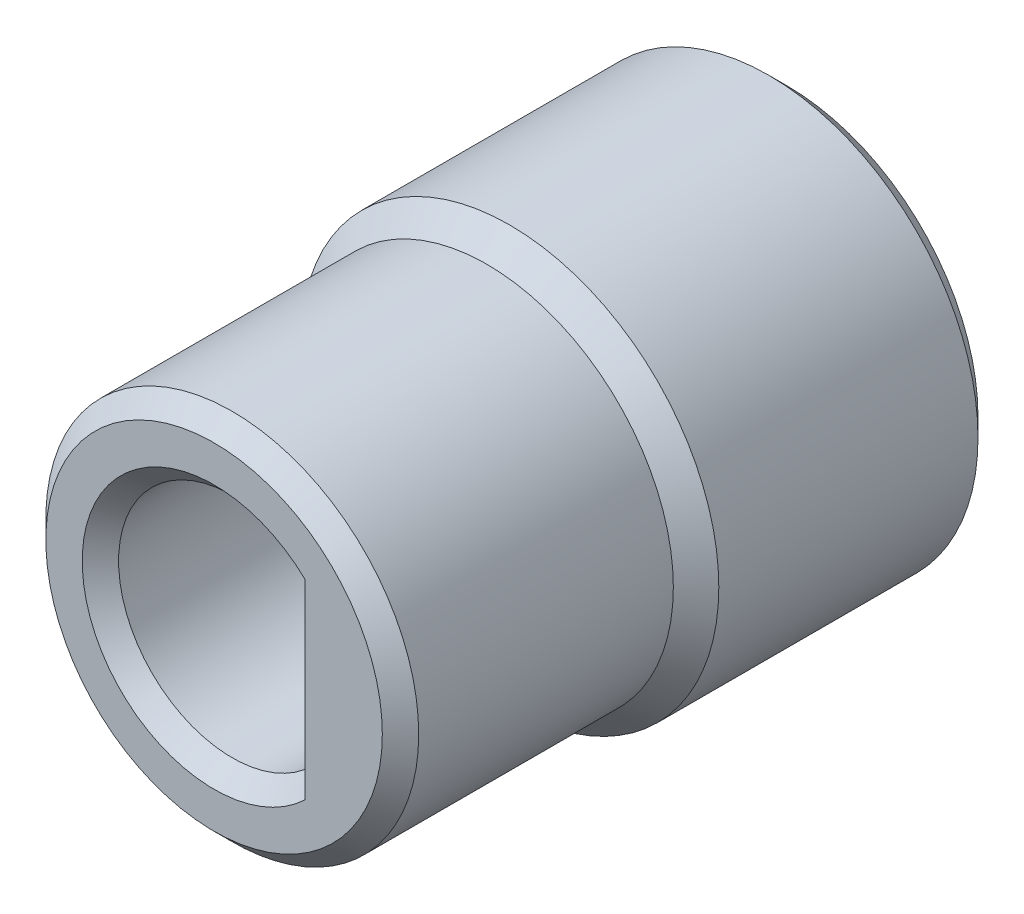
from build123d import *

# Parameters (mm, degrees)
SKETCH1_R           = 4.6
SKETCH1_R_2         = 3
BOSS_EXTRUDE1_DEPTH = 6.6
SKETCH2_R           = 4.1
BOSS_EXTRUDE2_DEPTH = 6
CHAMFER2_SIZE       = 0.5
CHAMFER3_SIZE       = 0.4
CHAMFER4_SIZE       = 0.4
CHAMFER4_SIZE2      = 0.8
CHAMFER5_SIZE       = 0.4


with BuildPart() as part:
    # Sketch1 → Boss-Extrude1 (new body)
    with BuildSketch(Plane.XY):
        Circle(SKETCH1_R)
        Circle(SKETCH1_R_2, mode=Mode.SUBTRACT)
    extrude(amount=BOSS_EXTRUDE1_DEPTH)

    # Sketch2 → Boss-Extrude2 (add)
    with BuildSketch(Plane.XY.offset(6.6)):
        Circle(SKETCH2_R)
        with BuildLine():
            Line((1.6, -1.920937271), (1.6, 1.920937271))
            ThreePointArc((1.6, 1.920937271), (-2.5, 0), (1.6, -1.920937271))
        make_face(mode=Mode.SUBTRACT)
    extrude(amount=BOSS_EXTRUDE2_DEPTH)

    # Chamfer2
    chamfer2_edges = [part.edges().sort_by_distance(p)[0] for p in [
        (-4.6, 0, 6.6),
    ]]
    chamfer(chamfer2_edges, length=CHAMFER2_SIZE - 0.0001)  # a hair under: the kernel refuses the full size

    # Chamfer3
    chamfer3_edges = [part.edges().sort_by_distance(p)[0] for p in [
        (-2.5, 0, 12.6),
        (1.6, 0, 12.6),
        (-3, 0, 0),
    ]]
    chamfer(chamfer3_edges, length=CHAMFER3_SIZE)

    # Chamfer4
    chamfer4_edges = [part.edges().sort_by_distance(p)[0] for p in [
        (-3, 0, 6.6),
    ]]
    chamfer4_side = [part.faces().sort_by_distance(p)[0] for p in [
        (-2.915147186, 0, 6.6),
    ]]
    chamfer(chamfer4_edges, length=CHAMFER4_SIZE, length2=CHAMFER4_SIZE2, reference=chamfer4_side[0])

    # Chamfer5
    chamfer5_edges = [part.edges().sort_by_distance(p)[0] for p in [
        (-4.1, 0, 12.6),
        (-4.6, 0, 0),
    ]]
    chamfer(chamfer5_edges, length=CHAMFER5_SIZE)


solid = part.part
